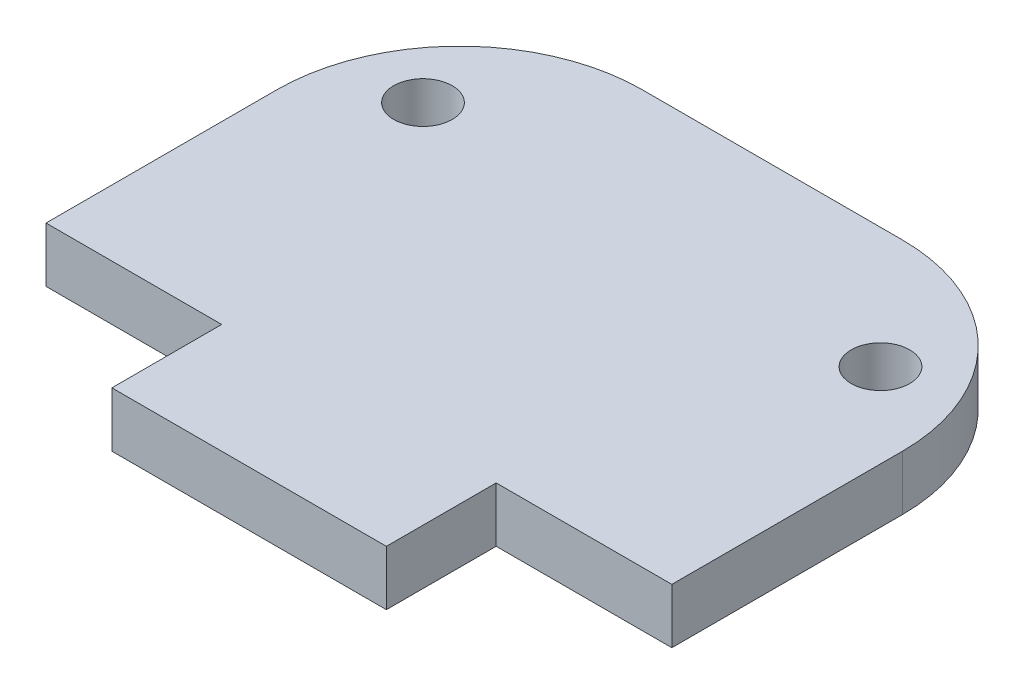
from build123d import *

# Parameters (mm, degrees)
ESBO_O1_R                = 1.6
RESSALTO_EXTRUS_O1_DEPTH = 3


with BuildPart() as part:
    # Esboço1 → Ressalto-extrusão1 (new body)
    with BuildSketch(Plane.XZ.offset(3)):
        with BuildLine():
            Line((-7.1, -28.6), (7.1, -28.6))
            ThreePointArc((7.1, -28.6), (14.171067812, -25.671067812), (17.1, -18.6))
            Line((17.1, -18.6), (17.1, -6))
            Line((17.1, -6), (7.5, -6))
            Line((7.5, -6), (7.5, 0))
            Line((7.5, 0), (-7.5, 0))
            Line((-7.5, 0), (-7.5, -6))
            Line((-7.5, -6), (-17.1, -6))
            Line((-17.1, -6), (-17.1, -18.6))
            ThreePointArc((-17.1, -18.6), (-14.171067812, -25.671067812), (-7.1, -28.6))
        make_face()
        with Locations((-12.5, -22)):
            Circle(ESBO_O1_R, mode=Mode.SUBTRACT)
        with Locations((12.5, -22)):
            Circle(ESBO_O1_R, mode=Mode.SUBTRACT)
    extrude(amount=-RESSALTO_EXTRUS_O1_DEPTH)


solid = part.part
